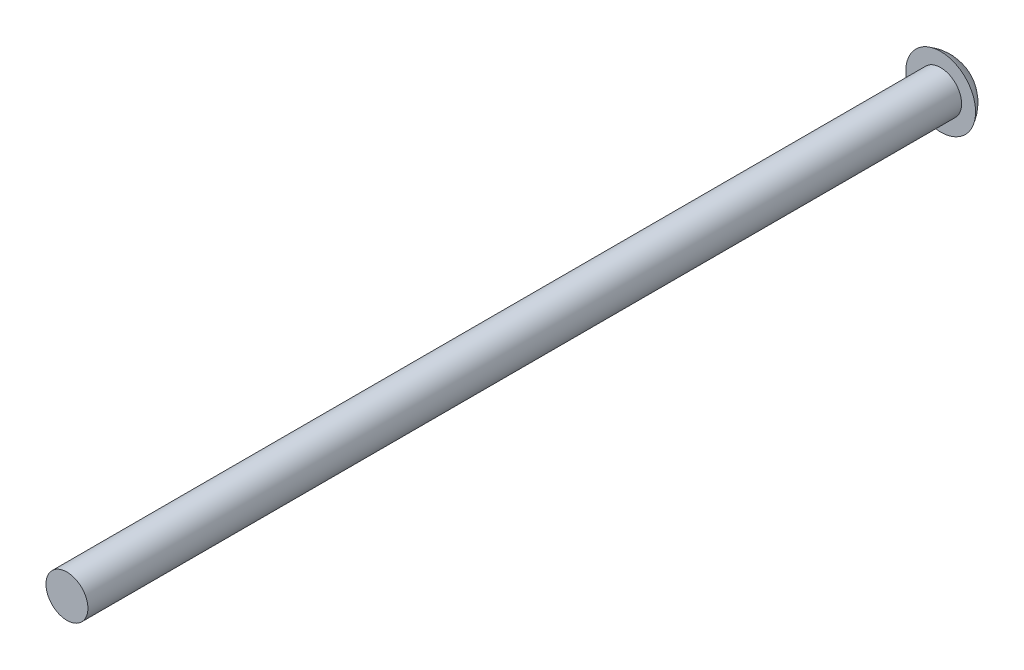
from build123d import *

# Parameters (mm, degrees)
SKETCH_1_R      = 3
EXTRUDE_1_DEPTH = 125


with BuildPart() as part:
    # 草图1 → 凸台-拉伸1 (new body)
    with BuildSketch(Plane.XY):
        Circle(SKETCH_1_R)
    extrude(amount=EXTRUDE_1_DEPTH)

    # 草图2 → 旋转1 (revolve)
    with BuildSketch(Plane(origin=(0, 0, 0), x_dir=(1, 0, 0), z_dir=(0, 1, 0))):
        with BuildLine():
            Line((0, 0), (5, 0))
            ThreePointArc((5, 0), (2.915475947, 2.192459912), (0, 3))
            Line((0, 3), (0, 0))
        make_face()
    revolve(axis=Axis((0, 0, 0), (0, 0, -1)))


solid = part.part
